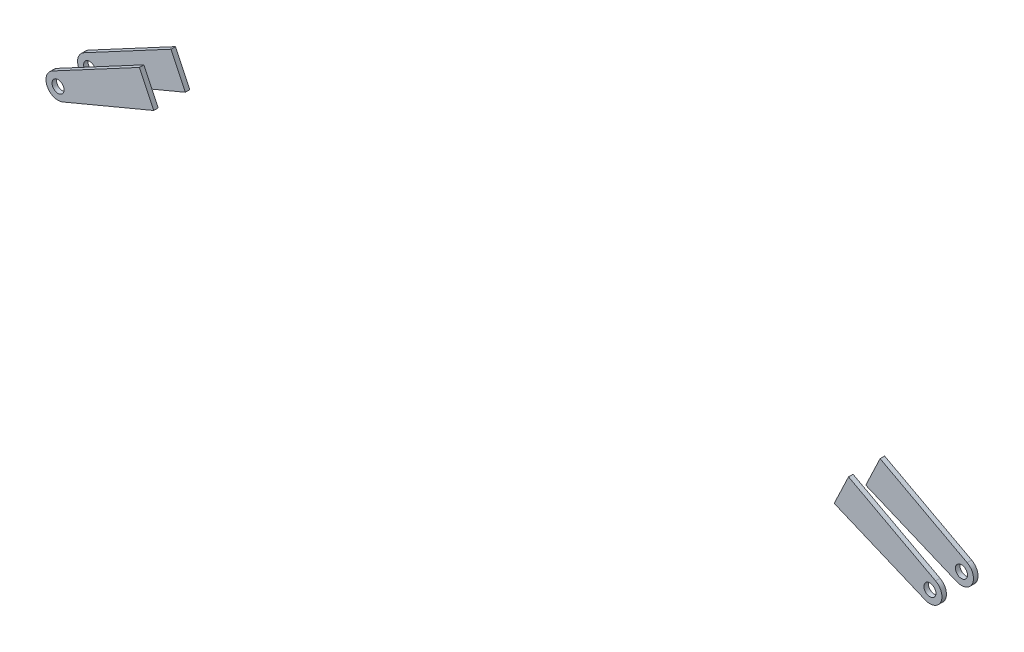
from build123d import *

# Parameters (mm, degrees)
BOSS_EXTRUDE1_START     = 174
BOSS_EXTRUDE1_OUTLINE_R = 4
BOSS_EXTRUDE1_DEPTH     = 3


# Read off the part's stored shape, not the designer's step: Boss-Extrude1
with BuildPart() as part:
    # Boss-Extrude1 outline → Boss-Extrude1 (new body)
    with BuildSketch(Plane.XY.offset(BOSS_EXTRUDE1_START)):
        with BuildLine():
            Line((235.873972271, -1931.963303044), (226.339589967, -1952.006407041))
            Line((226.339589967, -1952.006407041), (286.909061616, -1977.378760052))
            ThreePointArc((286.909061616, -1977.378760052), (297.224276082, -1973.436544062), (293.774454643, -1962.946384462))
            Line((293.774454643, -1962.946384462), (235.873972271, -1931.963303044))
        make_face()
        with Locations((290, -1970)):
            Circle(BOSS_EXTRUDE1_OUTLINE_R, mode=Mode.SUBTRACT)
    extrude(amount=BOSS_EXTRUDE1_DEPTH)


with BuildPart() as body_2:
    # Mirror1: mirrored copy
    add(part.part.mirror(Plane.XY.offset(165)))


with BuildPart() as body_3:
    # Mirror2: mirrored copy
    add(part.part.mirror(Plane(origin=(0, 0, 0), x_dir=(0, 0, 1), z_dir=(1, 0, 0))))


with BuildPart() as body_4:
    # Mirror2 2: mirrored copy
    add(body_2.part.mirror(Plane(origin=(0, 0, 0), x_dir=(0, 0, 1), z_dir=(1, 0, 0))))


solid = Compound([part.part, body_2.part, body_3.part, body_4.part])
